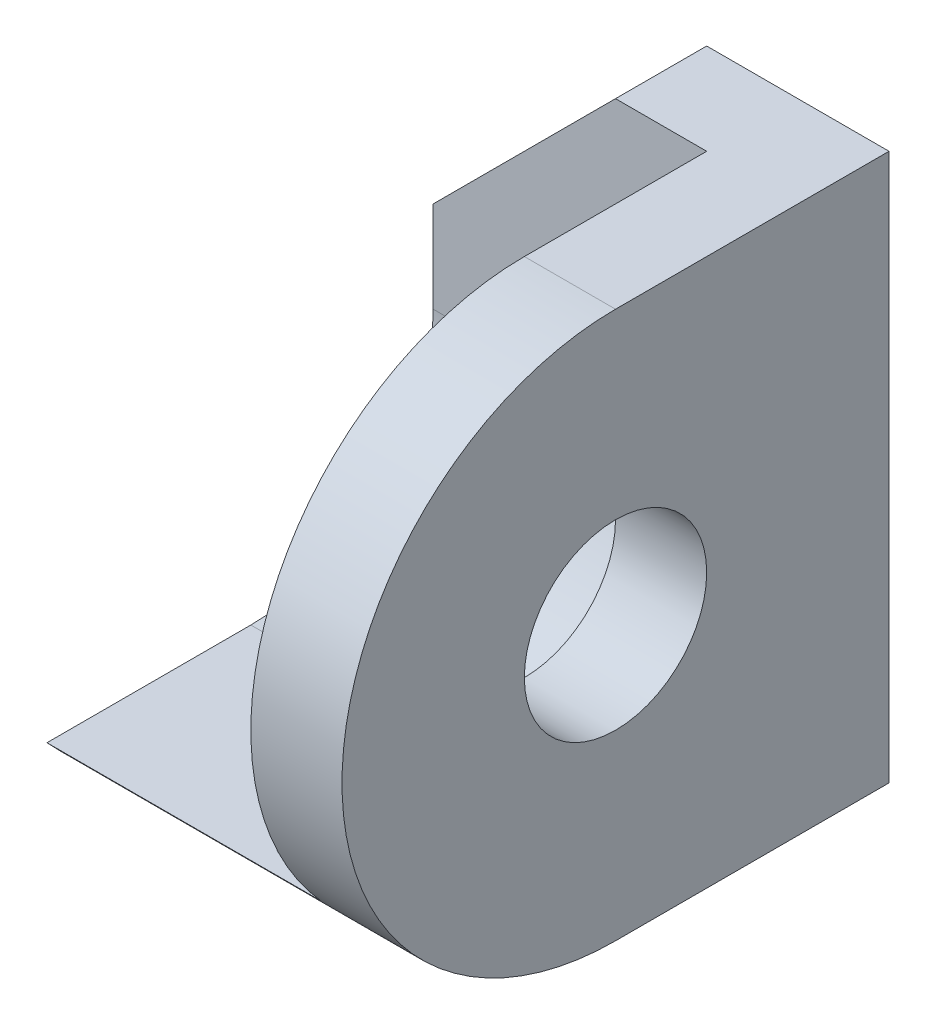
from build123d import *

# Parameters (mm, degrees)
BOSS_EXTRUDE1_DEPTH      = 1
BOSS_EXTRUDE1_DEPTH_BACK = 3
SKETCH1_R                = 1
CUT_EXTRUDE2_DEPTH       = 3
CHAMFER1_SIZE            = 2


with BuildPart() as part:
    # Sketch1 → Boss-Extrude1 (new, two sides: drawn at the far end of the back side and taken through both)
    with BuildSketch(Plane(origin=(0, 0, 0), x_dir=(0, 0, -1), z_dir=(1, 0, 0)).offset(-BOSS_EXTRUDE1_DEPTH_BACK)):
        with BuildLine():
            Line((0, 0), (0, 6))
            Line((0, 6), (-3, 6))
            ThreePointArc((-3, 6), (-6, 3), (-3, 0))
            Line((-3, 0), (0, 0))
        make_face()
        with Locations((-3, 3)):
            Circle(SKETCH1_R, mode=Mode.SUBTRACT)
    extrude(amount=BOSS_EXTRUDE1_DEPTH + BOSS_EXTRUDE1_DEPTH_BACK)

    # Sketch2 → Cut-Extrude2 (cut)
    with BuildSketch(Plane.ZY.offset(3)):
        with BuildLine():
            Line((3, 1), (7.614070683, 1))
            Line((7.614070683, 1), (7.614070683, 6.174190234))
            Line((7.614070683, 6.174190234), (1, 6.174190234))
            Line((1, 6.174190234), (1, 4.020419478))
            Line((1, 4.020419478), (1, 3))
            ThreePointArc((1, 3), (1.585786438, 1.585786438), (3, 1))
        make_face()
    extrude(amount=-CUT_EXTRUDE2_DEPTH, mode=Mode.SUBTRACT)

    # Chamfer1
    chamfer1_edges = [part.edges().sort_by_distance(p)[0] for p in [
        (-3, 6, 0.5),
    ]]
    chamfer(chamfer1_edges, length=CHAMFER1_SIZE)


solid = part.part
